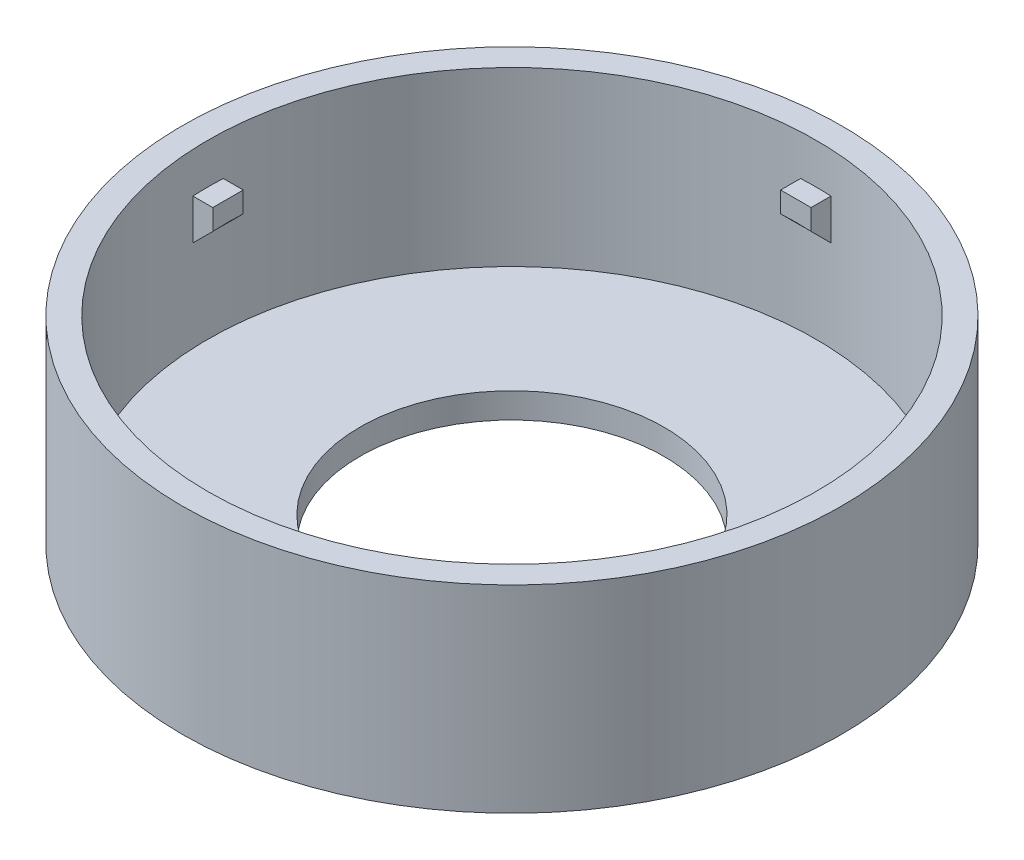
from build123d import *

# Parameters (mm, degrees)
SKETCH1_R           = 32.5
BOSS_EXTRUDE1_DEPTH = 2.5
SKETCH2_R           = 32.5
SKETCH2_R_2         = 30
BOSS_EXTRUDE2_DEPTH = 17
BOSS_EXTRUDE3_START = -2
BOSS_EXTRUDE3_DEPTH = 2
CHAMFER1_SIZE       = 2
SKETCH4_R           = 15
CUT_EXTRUDE1_DEPTH  = 50.005101775


with BuildPart() as part:
    # Sketch1 → Boss-Extrude1 (new body)
    with BuildSketch(Plane(origin=(0, 0, 0), x_dir=(1, 0, 0), z_dir=(0, 1, 0))):
        with Locations(Location((0, 0, 0), (0, 0, 270))):
            Circle(SKETCH1_R)
    extrude(amount=BOSS_EXTRUDE1_DEPTH)

    # Sketch2 → Boss-Extrude2 (add)
    with BuildSketch(Plane(origin=(0, 2.5, 0), x_dir=(1, 0, 0), z_dir=(0, 1, 0))):
        with Locations(Location((0, 0, 0), (0, 0, 270))):
            Circle(SKETCH2_R)
        with Locations(Location((0, 0, 0), (0, 0, 270))):
            Circle(SKETCH2_R_2, mode=Mode.SUBTRACT)
    extrude(amount=BOSS_EXTRUDE2_DEPTH)

    # Sketch3 → Boss-Extrude3 (add)
    with BuildSketch(Plane(origin=(0, 15.5, 0), x_dir=(1, 0, 0), z_dir=(0, 1, 0)).offset(BOSS_EXTRUDE3_START)):
        with BuildLine():
            Line((-1.5, 28), (1.5, 28))
            Line((1.5, 28), (1.5, 29.962476533))
            ThreePointArc((1.5, 29.962476533), (0, 30), (-1.5, 29.962476533))
            Line((-1.5, 29.962476533), (-1.5, 28))
        make_face()
        with BuildLine():
            Line((-28, 1.5), (-29.962476533, 1.5))
            ThreePointArc((-29.962476533, 1.5), (-30, 0), (-29.962476533, -1.5))
            Line((-29.962476533, -1.5), (-28, -1.5))
            Line((-28, -1.5), (-28, 1.5))
        make_face()
        with BuildLine():
            ThreePointArc((30, 0), (29.990617666, 0.750234632), (29.962476533, 1.5))
            Line((29.962476533, 1.5), (28, 1.5))
            Line((28, 1.5), (28, -1.5))
            Line((28, -1.5), (29.962476533, -1.5))
            ThreePointArc((29.962476533, -1.5), (29.990617666, -0.750234632), (30, 0))
        make_face()
        with BuildLine():
            ThreePointArc((-1.5, -29.962476533), (0, -30), (1.5, -29.962476533))
            Line((1.5, -29.962476533), (1.5, -28))
            Line((1.5, -28), (-1.5, -28))
            Line((-1.5, -28), (-1.5, -29.962476533))
        make_face()
    extrude(amount=BOSS_EXTRUDE3_DEPTH)

    # Chamfer1
    # the kernel refuses this chamfer: 2 mm, written as the material it adds along each edge
    with BuildSketch(Plane(origin=(0, 13.5, 0), x_dir=(0, 0, 1), z_dir=(-1, 0, 0))) as chamfer1_piece_1_section:
        Polygon((30, -CHAMFER1_SIZE), (30 - CHAMFER1_SIZE, 0), (30, 0), align=None)
    chamfer1_piece_1 = revolve(axis=Axis((0, 13.5, 0), (0, 1, 0)), revolution_arc=12.689093413, mode=Mode.PRIVATE)
    chamfer1_piece_1 = split(chamfer1_piece_1, bisect_by=Plane(origin=(1.5, 12.838755732, 29.330774017), z_dir=(-1, 0, 0)), keep=Keep.TOP, mode=Mode.PRIVATE)
    chamfer1_piece_1 = split(chamfer1_piece_1, bisect_by=Plane(origin=(0.749919513, 12.838755732, 28), z_dir=(0, 0, 1)), keep=Keep.TOP, mode=Mode.PRIVATE)
    add(chamfer1_piece_1)
    with BuildSketch(Plane(origin=(0, 13.5, 0), x_dir=(0.9755763292717098, 0, 0.21966070600982865), z_dir=(-0.21966070600982865, 0, 0.9755763292717098))) as chamfer1_piece_2_section:
        Polygon((30, -CHAMFER1_SIZE), (30 - CHAMFER1_SIZE, 0), (30, 0), align=None)
    chamfer1_piece_2 = revolve(axis=Axis((0, 13.5, 0), (0, 1, 0)), revolution_arc=25.378210829, mode=Mode.PRIVATE)
    chamfer1_piece_2 = split(chamfer1_piece_2, bisect_by=Plane(origin=(29.330774007, 12.838755737, 1.5), z_dir=(0, 0, -1)), keep=Keep.TOP, mode=Mode.PRIVATE)
    chamfer1_piece_2 = split(chamfer1_piece_2, bisect_by=Plane(origin=(29.330774007, 12.838755737, -1.5), z_dir=(0, 0, 1)), keep=Keep.TOP, mode=Mode.PRIVATE)
    chamfer1_piece_2 = split(chamfer1_piece_2, bisect_by=Plane(origin=(28, 12.838755737, 0), z_dir=(1, 0, 0)), keep=Keep.TOP, mode=Mode.PRIVATE)
    add(chamfer1_piece_2)
    with BuildSketch(Plane(origin=(0, 13.5, 0), x_dir=(0.21966070600991422, 0, -0.9755763292716906), z_dir=(0.9755763292716906, 0, 0.21966070600991422))) as chamfer1_piece_3_section:
        Polygon((30, -CHAMFER1_SIZE), (30 - CHAMFER1_SIZE, 0), (30, 0), align=None)
    chamfer1_piece_3 = revolve(axis=Axis((0, 13.5, 0), (0, 1, 0)), revolution_arc=25.378210829, mode=Mode.PRIVATE)
    chamfer1_piece_3 = split(chamfer1_piece_3, bisect_by=Plane(origin=(1.5, 12.838755737, -29.330774007), z_dir=(-1, 0, 0)), keep=Keep.TOP, mode=Mode.PRIVATE)
    chamfer1_piece_3 = split(chamfer1_piece_3, bisect_by=Plane(origin=(-1.5, 12.838755737, -29.330774007), z_dir=(1, 0, 0)), keep=Keep.TOP, mode=Mode.PRIVATE)
    chamfer1_piece_3 = split(chamfer1_piece_3, bisect_by=Plane(origin=(0, 12.838755737, -28), z_dir=(0, 0, -1)), keep=Keep.TOP, mode=Mode.PRIVATE)
    add(chamfer1_piece_3)
    with BuildSketch(Plane(origin=(0, 13.5, 0), x_dir=(-0.9755763292716926, 0, -0.21966070600990492), z_dir=(0.21966070600990492, 0, -0.9755763292716926))) as chamfer1_piece_4_section:
        Polygon((30, -CHAMFER1_SIZE), (30 - CHAMFER1_SIZE, 0), (30, 0), align=None)
    chamfer1_piece_4 = revolve(axis=Axis((0, 13.5, 0), (0, 1, 0)), revolution_arc=25.378210829, mode=Mode.PRIVATE)
    chamfer1_piece_4 = split(chamfer1_piece_4, bisect_by=Plane(origin=(-29.330774007, 12.838755737, -1.5), z_dir=(0, 0, 1)), keep=Keep.TOP, mode=Mode.PRIVATE)
    chamfer1_piece_4 = split(chamfer1_piece_4, bisect_by=Plane(origin=(-29.330774007, 12.838755737, 1.5), z_dir=(0, 0, -1)), keep=Keep.TOP, mode=Mode.PRIVATE)
    chamfer1_piece_4 = split(chamfer1_piece_4, bisect_by=Plane(origin=(-28, 12.838755737, 0), z_dir=(-1, 0, 0)), keep=Keep.TOP, mode=Mode.PRIVATE)
    add(chamfer1_piece_4)
    with BuildSketch(Plane(origin=(0, 13.5, 0), x_dir=(-0.2196605016666056, 0, 0.9755763752815949), z_dir=(-0.9755763752815949, 0, -0.2196605016666056))) as chamfer1_piece_5_section:
        Polygon((30, -CHAMFER1_SIZE), (30 - CHAMFER1_SIZE, 0), (30, 0), align=None)
    chamfer1_piece_5 = revolve(axis=Axis((0, 13.5, 0), (0, 1, 0)), revolution_arc=12.689093413, mode=Mode.PRIVATE)
    chamfer1_piece_5 = split(chamfer1_piece_5, bisect_by=Plane(origin=(-1.5, 12.838755737, 29.330774007), z_dir=(1, 0, 0)), keep=Keep.TOP, mode=Mode.PRIVATE)
    chamfer1_piece_5 = split(chamfer1_piece_5, bisect_by=Plane(origin=(-0.749919511, 12.838755737, 28), z_dir=(0, 0, 1)), keep=Keep.TOP, mode=Mode.PRIVATE)
    add(chamfer1_piece_5)

    # Sketch4 → Cut-Extrude1 (cut, through all)
    with BuildSketch(Plane(origin=(0, 2.5, 0), x_dir=(1, 0, 0), z_dir=(0, 1, 0))):
        with Locations(Location((0, 0, 0), (0, 0, 270))):
            Circle(SKETCH4_R)
    extrude(amount=-CUT_EXTRUDE1_DEPTH, mode=Mode.SUBTRACT)


solid = part.part
